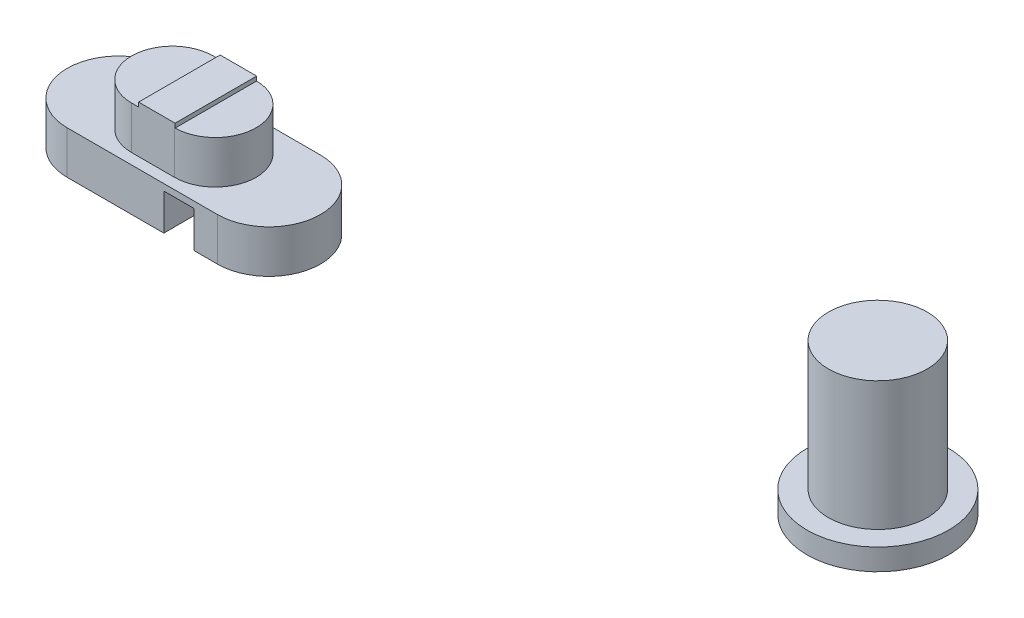
from build123d import *

# Parameters (mm, degrees)
SKETCH_1_R          = 3.3
EXTRUDE_1_DEPTH     = 1
SKETCH_1_3_R        = 2.3
EXTRUDE_2_DEPTH     = 6
EXTRUDE_3_DEPTH     = 2
EXTRUDE_4_DEPTH     = 2
SKETCH_2_W          = 1.4
SKETCH_2_H          = 1.7
CUT_EXTRUDE_1_DEPTH = 37.678033239
SKETCH_3_W          = 1.700465275
SKETCH_3_H          = 3.8
EXTRUDE_5_DEPTH     = 0.2


with BuildPart() as part:
    # 草图1 → 凸台-拉伸1 (new body)
    with BuildSketch(Plane(origin=(0, 0, 0), x_dir=(1, 0, 0), z_dir=(0, 1, 0))):
        Circle(SKETCH_1_R)
    extrude(amount=-EXTRUDE_1_DEPTH)

    # 草图1<3> → 凸台-拉伸2 (add)
    with BuildSketch(Plane(origin=(0, 0, 0), x_dir=(1, 0, 0), z_dir=(0, 1, 0))):
        Circle(SKETCH_1_3_R)
    extrude(amount=EXTRUDE_2_DEPTH)


with BuildPart() as body_2:
    # 草图1<5> → 凸台-拉伸3 (new body)
    with BuildSketch(Plane(origin=(0, 0, 0), x_dir=(1, 0, 0), z_dir=(0, 1, 0))):
        with BuildLine():
            Line((-26.464162089, 0.5), (-33.464162089, 0.5))
            ThreePointArc((-33.464162089, 0.5), (-35.864162089, -1.9), (-33.464162089, -4.3))
            Line((-33.464162089, -4.3), (-26.464162089, -4.3))
            ThreePointArc((-26.464162089, -4.3), (-24.064162089, -1.9), (-26.464162089, 0.5))
        make_face()
    extrude(amount=-EXTRUDE_3_DEPTH)

    # 草图1<6> → 凸台-拉伸4 (add)
    with BuildSketch(Plane(origin=(0, 0, 0), x_dir=(1, 0, 0), z_dir=(0, 1, 0))):
        with BuildLine():
            Line((-28.964162089, 0), (-30.964162089, 0))
            ThreePointArc((-30.964162089, 0), (-32.864162089, -1.9), (-30.964162089, -3.8))
            Line((-30.964162089, -3.8), (-28.964162089, -3.8))
            ThreePointArc((-28.964162089, -3.8), (-27.064162089, -1.9), (-28.964162089, 0))
        make_face()
    extrude(amount=EXTRUDE_4_DEPTH)

    # 草图2 → 切除-拉伸1 (cut, through all)
    with BuildSketch(Plane(origin=(0, 0, -0.5), x_dir=(-1, 0, 0), z_dir=(0, 0, -1))):
        with Locations((28.264162089, -1.15)):
            Rectangle(SKETCH_2_W, SKETCH_2_H)
    extrude(amount=-CUT_EXTRUDE_1_DEPTH, mode=Mode.SUBTRACT)

    # 草图3 → 凸台-拉伸5 (add)
    with BuildSketch(Plane(origin=(0, 2, 0), x_dir=(1, 0, 0), z_dir=(0, 1, 0))):
        with Locations((-29.788449326, -1.9)):
            Rectangle(SKETCH_3_W, SKETCH_3_H)
    extrude(amount=EXTRUDE_5_DEPTH)


solid = Compound([part.part, body_2.part])
